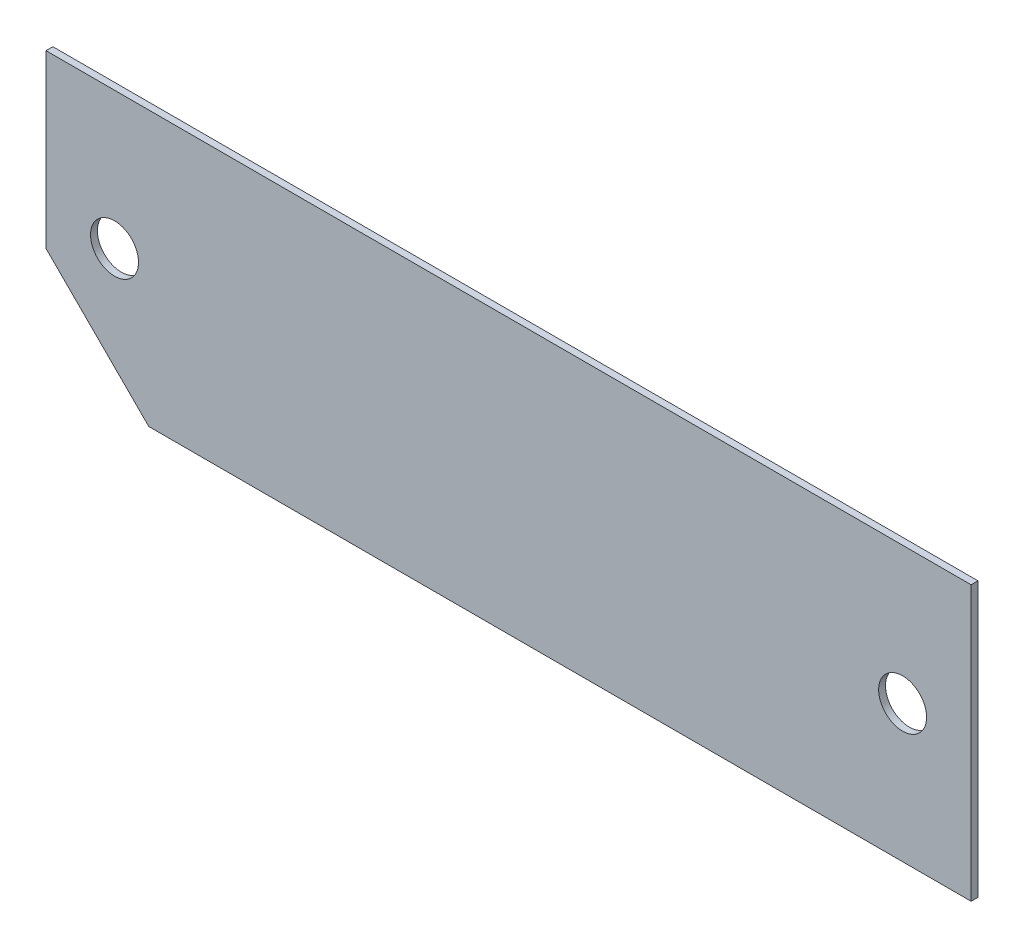
from build123d import *

# Parameters (mm, degrees)
SKETCH_1_W             = 135
SKETCH_1_H             = 40
SKETCH_1_R             = 3.5
SM_BASE_FLANGE_1_DEPTH = 1
CHAMFER_1_SIZE         = 15


# Sheet-metal steps are written as plain solids
with BuildPart() as part:
    # Sketch 1 → Базовая кромка1 (new body)
    with BuildSketch(Plane.XY):
        Rectangle(SKETCH_1_W, SKETCH_1_H)
        with Locations((-57.5, 0)):
            Circle(SKETCH_1_R, mode=Mode.SUBTRACT)
        with Locations(Location((57.5, 0, 0), (0, 0, 180))):
            Circle(SKETCH_1_R, mode=Mode.SUBTRACT)
    extrude(amount=-SM_BASE_FLANGE_1_DEPTH)

    # Фаска1
    chamfer_1_edges = [part.edges().sort_by_distance(p)[0] for p in [
        (-67.5, -20, -0.5),
    ]]
    chamfer(chamfer_1_edges, length=CHAMFER_1_SIZE)


solid = part.part
